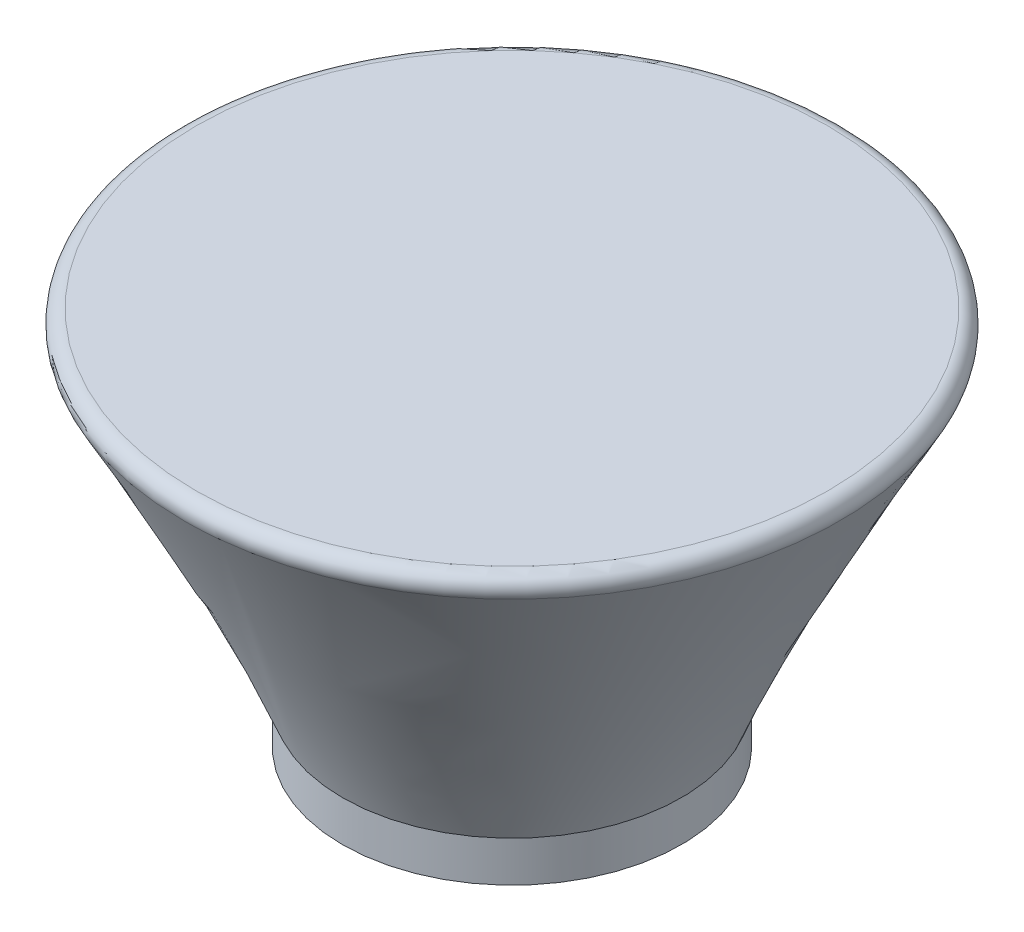
from build123d import *

# Parameters (mm, degrees)
SKETCH1_R           = 2.5
BOSS_EXTRUDE1_DEPTH = 0.6
FILLET1_R           = 0.2


with BuildPart() as part:
    # Sketch1 → Boss-Extrude1 (new body)
    with BuildSketch(Plane(origin=(0, 0, 0), x_dir=(1, 0, 0), z_dir=(0, 1, 0))):
        with Locations(Location((0, 0, 0), (0, 0, 270))):
            Circle(SKETCH1_R)
    extrude(amount=BOSS_EXTRUDE1_DEPTH)

    # Loft1: read off the stored shape, not the designer's step
    # Loft1: loft between two sections, ruled curve by curve
    loft1_from = [
        Edge.make_bspline([(-0.886625195, 0.6, 2.337497757), (3.788370319, 0.6, 4.110748147), (5.561620709, 0.6, -0.564247367), (0.886625195, 0.6, -2.337497757), (-3.788370319, 0.6, -4.110748147), (-5.561620709, 0.6, 0.564247367), (-0.886625195, 0.6, 2.337497757)], [0, 0, 0, 0, 0.5, 0.5, 0.5, 1, 1, 1, 1], 3, [1, 0.333333333, 0.333333333, 1, 0.333333333, 0.333333333, 1]),
    ]
    loft1_to = [
        Edge.make_bspline([(0.573645482, 5.6, 4.966984081), (10.507613644, 5.6, 3.819693116), (9.36032268, 5.6, -6.114275046), (-0.573645482, 5.6, -4.966984081), (-10.507613644, 5.6, -3.819693116), (-9.36032268, 5.6, 6.114275046), (0.573645482, 5.6, 4.966984081)], [0, 0, 0, 0, 0.5, 0.5, 0.5, 1, 1, 1, 1], 3, [1, 0.333333333, 0.333333333, 1, 0.333333333, 0.333333333, 1]),
    ]
    loft1 = Solid(Shell([*[Face.make_surface_from_curves(loft1_from[k], loft1_to[k]) for k in range(1)], Face(Wire(loft1_from)), Face(Wire(loft1_to))]))
    add(loft1)

    # Fillet1
    fillet1_edges = [part.edges().sort_by_distance(p)[0] for p in [
        (-0.573645482, 5.6, -4.966984081),
    ]]
    fillet(fillet1_edges, radius=FILLET1_R)


solid = part.part
